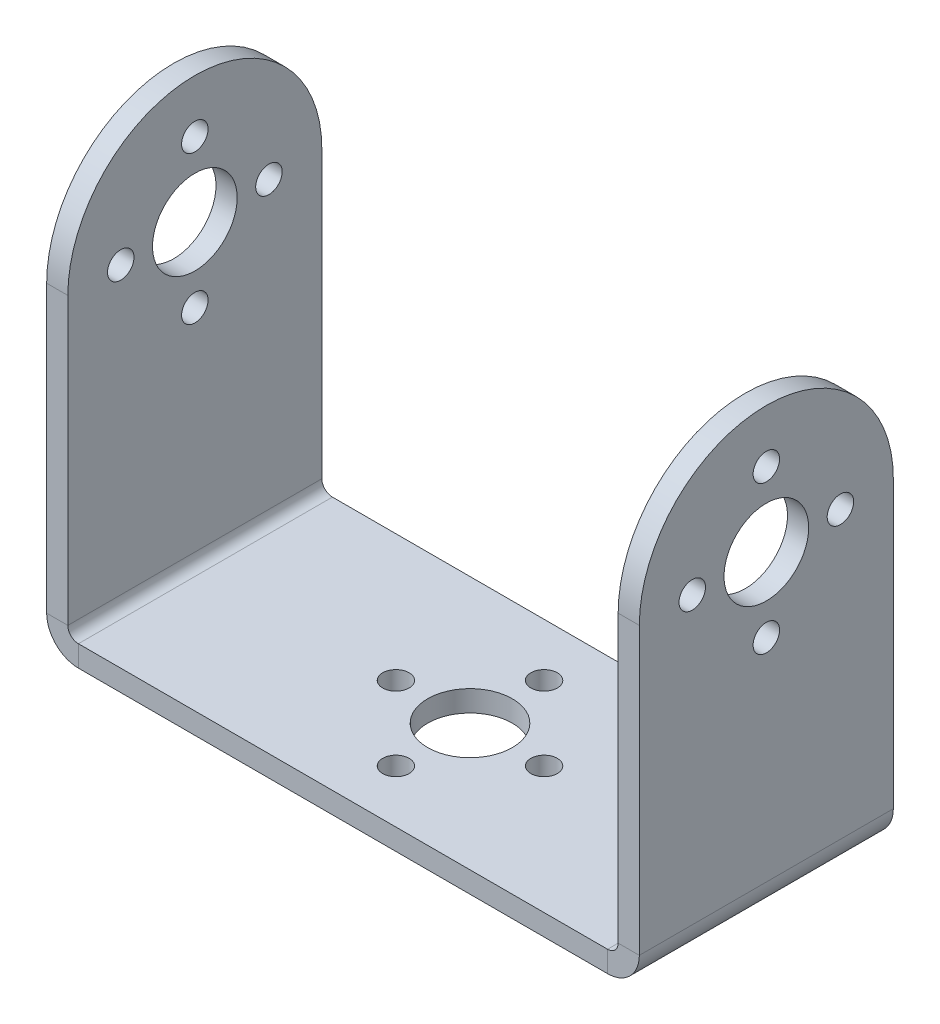
from build123d import *

# Parameters (mm, degrees)
T_LE_DE_BASE_PLI_E1_DEPTH       = 12
ENL_V_START                     = -56
ENL_V_MAT_EXTRU_1_DEPTH         = 56
DIAM_TRE_DU_PER_AGE_8_0_8_1_D   = 8
DIAM_TRE_DU_PER_AGE_2_5_2_5_1_D = 2.5
DIAM_TRE_DU_PER_AGE_8_0_8_2_D   = 8
DIAM_TRE_DU_PER_AGE_2_5_2_5_2_D = 2.5


# Read off the part's stored shape, not the designer's step: Enlèv. mat.-Extru.1
# Sheet-metal steps are written as plain solids
with BuildPart() as part:
    # Esquisse1 → Tôle de base pliée1 (new, symmetric)
    with BuildSketch(Plane.XY):
        with BuildLine():
            Line((-28, 42), (-28, 3))
            ThreePointArc((-28, 3), (-27.121320344, 0.878679656), (-25, 0))
            Line((-25, 0), (25, 0))
            ThreePointArc((25, 0), (27.121320344, 0.878679656), (28, 3))
            Line((28, 3), (28, 42))
            Line((28, 42), (26, 42))
            Line((26, 42), (26, 3))
            ThreePointArc((26, 3), (25.707106781, 2.292893219), (25, 2))
            Line((25, 2), (-25, 2))
            ThreePointArc((-25, 2), (-25.707106781, 2.292893219), (-26, 3))
            Line((-26, 3), (-26, 42))
            Line((-26, 42), (-28, 42))
        make_face()
    extrude(amount=T_LE_DE_BASE_PLI_E1_DEPTH, both=True)

    # Enlèv. mat.-Extru.1 outline → Enlèv. mat.-Extru.1 (cut)
    with BuildSketch(Plane(origin=(28, 0, 0), x_dir=(0, 0, -1), z_dir=(1, 0, 0)).offset(ENL_V_START)):
        with BuildLine():
            ThreePointArc((-12, 30), (-8.485281374, 38.485281374), (0, 42))
            Line((0, 42), (-12, 42))
            Line((-12, 42), (-12, 30))
        make_face()
        with BuildLine():
            ThreePointArc((0, 42), (8.485281374, 38.485281374), (12, 30))
            Line((12, 30), (12, 42))
            Line((12, 42), (0, 42))
        make_face()
    extrude(amount=ENL_V_MAT_EXTRU_1_DEPTH, mode=Mode.SUBTRACT)

    # Diamètre du perçage Ø8.0 (8)1 (through all)
    with Locations(Plane(origin=(28, 0, 0), x_dir=(0, 0, -1), z_dir=(1, 0, 0))):
        with Locations((0, 30)):
            Hole(DIAM_TRE_DU_PER_AGE_8_0_8_1_D / 2)

    # Diamètre du perçage Ø2.5 (2.5)1 (through all)
    with Locations(Plane(origin=(28, 0, 0), x_dir=(0, 0, -1), z_dir=(1, 0, 0))):
        with Locations((0, 37), (7, 30), (0, 23), (-7, 30)):
            Hole(DIAM_TRE_DU_PER_AGE_2_5_2_5_1_D / 2)

    # Diamètre du perçage Ø8.0 (8)2 (through all)
    with Locations(Plane(origin=(0, 2, 0), x_dir=(1, 0, 0), z_dir=(0, 1, 0))):
        with Locations((0, 0)):
            Hole(DIAM_TRE_DU_PER_AGE_8_0_8_2_D / 2)

    # Diamètre du perçage Ø2.5 (2.5)2 (through all)
    with Locations(Plane(origin=(0, 2, 0), x_dir=(1, 0, 0), z_dir=(0, 1, 0))):
        with Locations((0, 7), (7, 0), (0, -7), (-7, 0)):
            Hole(DIAM_TRE_DU_PER_AGE_2_5_2_5_2_D / 2)


solid = part.part
